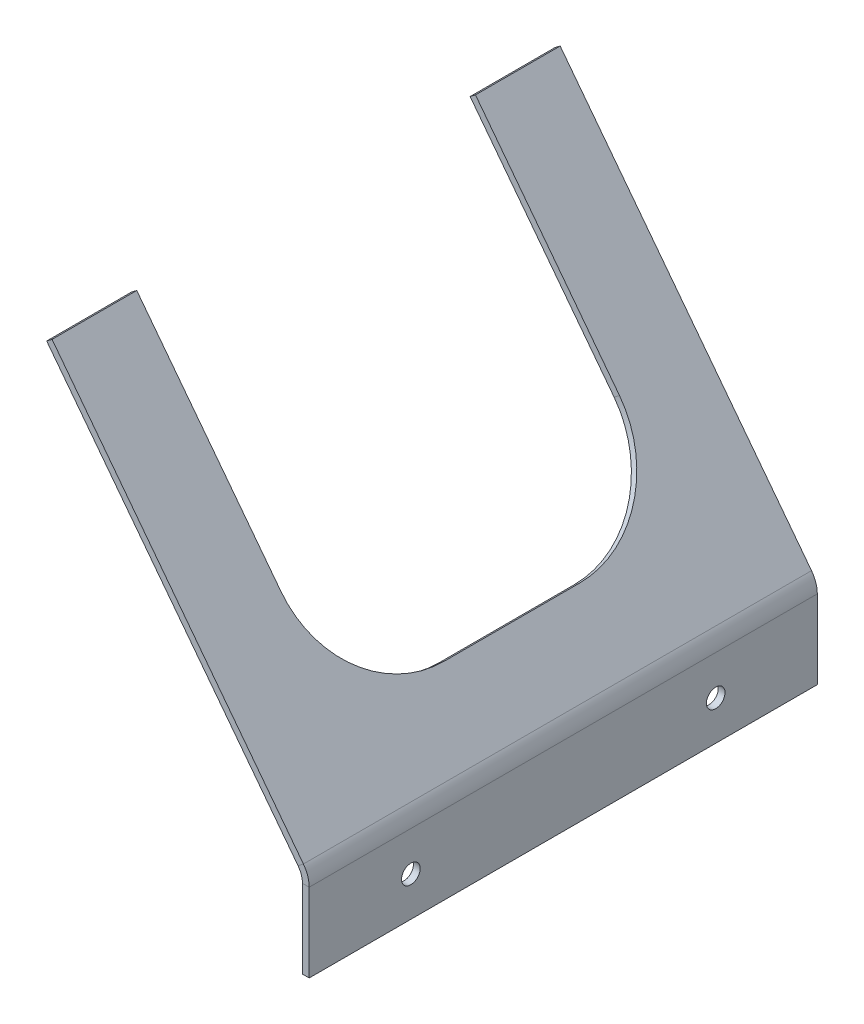
from build123d import *

# Parameters (mm, degrees)
ODGI_CIE_BAZOWE1_DEPTH     = 150
SZKIC8_W                   = 100
SZKIC8_H                   = 100
WYTNIJ_WYCI_GNI_CIE3_DEPTH = 10
ZAOKR_GLENIE3_R            = 30
ZAOKR_GLENIE4_R            = 30
OTW_R_POD_RUB_M51_D        = 5.5
OTW_R_POD_RUB_M51_DEPTH    = 14
OTW_R_POD_RUB_M51_TIP      = 1.652366702


# Sheet-metal steps are written as plain solids
with BuildPart() as part:
    # Szkic1 → Odgięcie bazowe1 (new body)
    with BuildSketch(Plane.XY):
        with BuildLine():
            Line((1038.6, -647.5), (1038.6, -624.284884098))
            ThreePointArc((1038.6, -624.284884098), (1038.264712868, -622.248777737), (1037.294258546, -620.427688781))
            Line((1037.294258546, -620.427688781), (963.094449397, -523.392669649))
            Line((963.094449397, -523.392669649), (964.683192246, -522.177804982))
            Line((964.683192246, -522.177804982), (1038.883001396, -619.212824114))
            ThreePointArc((1038.883001396, -619.212824114), (1040.159110622, -621.607484395), (1040.6, -624.284884098))
            Line((1040.6, -624.284884098), (1040.6, -647.5))
            Line((1040.6, -647.5), (1038.6, -647.5))
        make_face()
    extrude(amount=ODGI_CIE_BAZOWE1_DEPTH)

    # Szkic8 → Wytnij-wyciągnięcie3 (cut)
    with BuildSketch(Plane(origin=(355.1865636, 271.600659919, 0), x_dir=(0, 0, 1), z_dir=(-0.7943714246171976, -0.607432333475626, 0))):
        with Locations((75, -1050.782889378)):
            Rectangle(SZKIC8_W, SZKIC8_H)
    extrude(amount=-WYTNIJ_WYCI_GNI_CIE3_DEPTH, mode=Mode.SUBTRACT)

    # Zaokrąglenie3
    zaokr_glenie3_edges = [part.edges().sort_by_distance(p)[0] for p in [
        (1024.632054169, -602.222379777, 125),
    ]]
    fillet(zaokr_glenie3_edges, radius=ZAOKR_GLENIE3_R)

    # Zaokrąglenie4
    zaokr_glenie4_edges = [part.edges().sort_by_distance(p)[0] for p in [
        (1024.632054169, -602.222379777, 25),
    ]]
    fillet(zaokr_glenie4_edges, radius=ZAOKR_GLENIE4_R)

    # Otwór pod śrubę M51
    with Locations(Plane(origin=(1040.6, 0, 0), x_dir=(0, 0, -1), z_dir=(1, 0, 0))):
        with Locations((-30, -635.892442049), (-120, -635.892442049)):
            Hole(OTW_R_POD_RUB_M51_D / 2, depth=OTW_R_POD_RUB_M51_DEPTH)
            with Locations((0, 0, -(OTW_R_POD_RUB_M51_DEPTH + OTW_R_POD_RUB_M51_TIP / 2))):  # 118° drill point
                Cone(0, OTW_R_POD_RUB_M51_D / 2, OTW_R_POD_RUB_M51_TIP, mode=Mode.SUBTRACT)


solid = part.part
